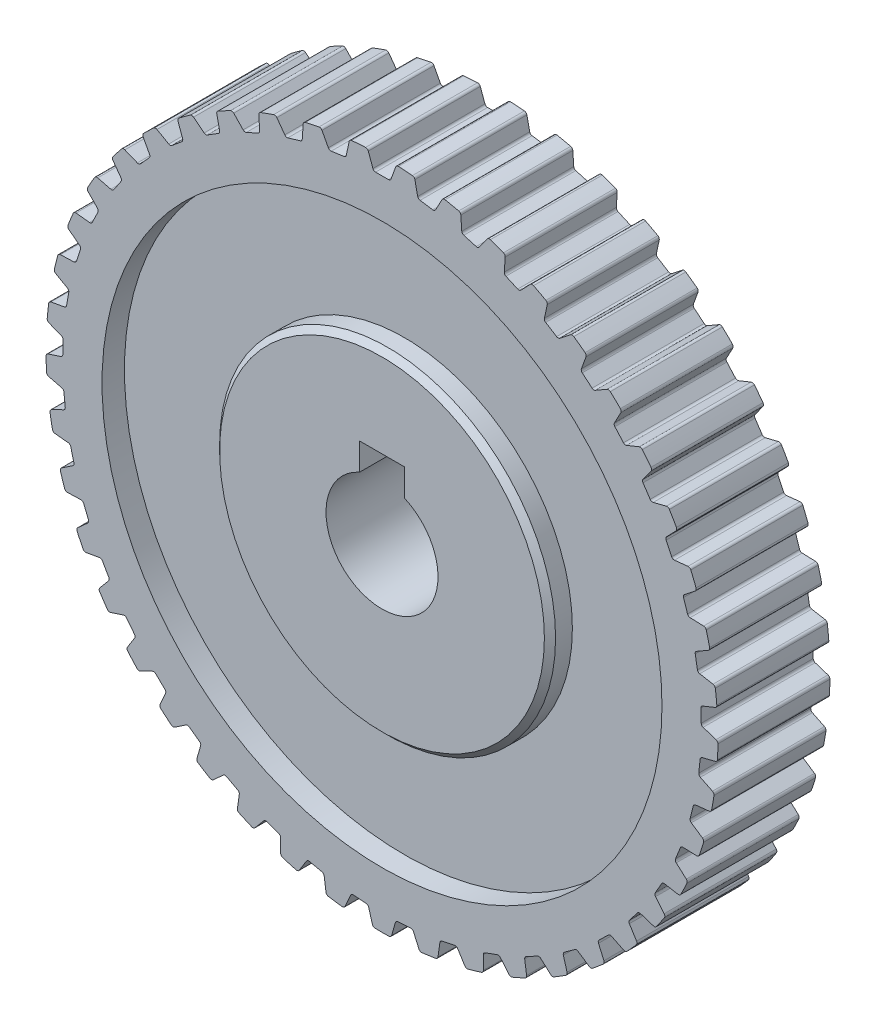
from build123d import *

# Parameters (mm, degrees)
SKETCH1_R               = 30
BOSS_EXTRUDE1_DEPTH     = 10
CUT_EXTRUDE2_DEPTH      = 44.588989435
CIRPATTERN1_COUNT       = 45
SKETCH3_R               = 25
SKETCH3_R_2             = 15
CUT_EXTRUDE_THIN1_DEPTH = 2
CHAMFER1_SIZE           = 0.5
CHAMFER2_SIZE           = 0.5
FILLET1_R               = 0.25


with BuildPart() as part:
    # Sketch1 → Boss-Extrude1 (new body)
    with BuildSketch(Plane.XY):
        Circle(SKETCH1_R)
        with BuildLine():
            ThreePointArc((2, 4.582575695), (0, -5), (-2, 4.582575695))
            Line((-2, 4.582575695), (-2, 7))
            Line((-2, 7), (2, 7))
            Line((2, 7), (2, 4.582575695))
        make_face(mode=Mode.SUBTRACT)
    extrude(amount=BOSS_EXTRUDE1_DEPTH)

    # Sketch2 → Cut-Extrude2 (cut, through all)
    with BuildSketch(Plane.XY.offset(10)):
        with BuildLine():
            Line((-0.75, 28.5), (0.75, 28.5))
            Line((0.75, 28.5), (1.285919783, 29.972427501))
            ThreePointArc((1.285919783, 29.972427501), (0, 30), (-1.285919783, 29.972427501))
            Line((-1.285919783, 29.972427501), (-0.75, 28.5))
        make_face()
    cut_extrude2 = extrude(amount=-CUT_EXTRUDE2_DEPTH, mode=Mode.SUBTRACT)

    # CirPattern1: Cut-Extrude2 ×45 about axis
    cirpattern1_axis = Axis((0, 0, 10), (0, 0, -1))
    for i in range(1, CIRPATTERN1_COUNT):
        add(cut_extrude2.rotate(cirpattern1_axis, i * 360 / CIRPATTERN1_COUNT), mode=Mode.SUBTRACT)

    # Sketch3 → Cut-Extrude-Thin1 (cut)
    with BuildSketch(Plane.XY.offset(10)):
        Circle(SKETCH3_R)
        Circle(SKETCH3_R_2, mode=Mode.SUBTRACT)
    cut_extrude_thin1 = extrude(amount=-CUT_EXTRUDE_THIN1_DEPTH, mode=Mode.SUBTRACT)

    # Chamfer1
    chamfer1_edges = [part.edges().sort_by_distance(p)[0] for p in [
        (-15, 0, 10),
    ]]
    chamfer(chamfer1_edges, length=CHAMFER1_SIZE)

    # Mirror1: Cut-Extrude-Thin1 across plane
    add(cut_extrude_thin1.mirror(Plane.XY.offset(5)), mode=Mode.SUBTRACT)

    # Chamfer2
    chamfer2_edges = [part.edges().sort_by_distance(p)[0] for p in [
        (-15, 0, 0),
    ]]
    chamfer(chamfer2_edges, length=CHAMFER2_SIZE)

    # Fillet1
    fillet1_edges = [part.edges().sort_by_distance(p)[0] for p in [
        (29.942650626, -1.854096408, 5),
        (13.365630723, 26.858144303, 5),
        (12.277153421, 25.730993061, 5),
        (10.906835234, 26.341098025, 5),
        (11.01613837, 27.904205694, 5),
        (9.497626095, 28.456898963, 5),
        (8.576610913, 27.189230317, 5),
        (7.134718369, 27.602686351, 5),
        (7.025415233, 29.16579402, 5),
        (5.444760978, 29.501772453, 5),
        (4.709134429, 28.118260133, 5),
        (3.223732326, 28.327019785, 5),
        (2.897950379, 29.859703341, 5),
        (1.285919783, 29.972427501, 5),
        (0.75, 28.5, 5),
        (-0.75, 28.5, 5),
        (-1.285919783, 29.972427501, 5),
        (-2.897950379, 29.859703341, 5),
        (-3.223732326, 28.327019785, 5),
        (-4.709134429, 28.118260133, 5),
        (-5.444760978, 29.501772453, 5),
        (-7.025415233, 29.16579402, 5),
        (-7.134718369, 27.602686351, 5),
        (-8.576610913, 27.189230317, 5),
        (-9.497626095, 28.456898963, 5),
        (-11.01613837, 27.904205694, 5),
        (-10.906835234, 26.341098025, 5),
        (-12.277153421, 25.730993061, 5),
        (-13.365630723, 26.858144303, 5),
        (-14.792444905, 26.099493745, 5),
        (-14.466662959, 24.566810189, 5),
        (-15.738735103, 23.771931292, 5),
        (-16.973488552, 24.736626415, 5),
        (-18.280833326, 23.786784837, 5),
        (-17.744913544, 22.314357336, 5),
        (-18.893980208, 21.350175922, 5),
        (-20.250976734, 22.133638231, 5),
        (-21.413406121, 21.01109322, 5),
        (-20.677779571, 19.6275809, 5),
        (-21.681475481, 18.512863662, 5),
        (-23.134302688, 19.099843956, 5),
        (-24.129191322, 17.826444573, 5),
        (-23.20817614, 16.558775928, 5),
        (-24.046965495, 15.31521957, 5),
        (-25.567345756, 15.694292943, 5),
        (-26.375329261, 14.29482446, 5),
        (-25.286851959, 13.167673218, 5),
        (-25.94440868, 11.819482149, 5),
        (-27.502749521, 11.983270371, 5),
        (-28.108101418, 10.484971849, 5),
        (-26.873347969, 9.520276727, 5),
        (-27.33687346, 8.093691952, 5),
        (-28.90284355, 8.039007072, 5),
        (-29.293781353, 6.471041187, 5),
        (-27.936784828, 5.687578878, 5),
        (-28.197257094, 4.210367249, 5),
        (-29.740376607, 3.938273644, 5),
        (-29.909291155, 2.33115907, 5),
        (-28.456463948, 1.744178776, 5),
        (-28.508813193, 0.245092536, 5),
        (-29.999047061, -0.2391138, 5),
        (-29.942650626, -1.854096408, 5),
        (-28.422270365, -2.233169782, 5),
        (-28.265477671, -3.724952625, 5),
        (-29.673820188, -4.411847167, 5),
        (-29.393210462, -6.003264007, 5),
        (-27.834869621, -6.16705223, 5),
        (-27.471986777, -7.622495819, 5),
        (-28.771026159, -8.498708946, 5),
        (-28.27166489, -10.035584902, 5),
        (-26.7056948, -9.980900021, 5),
        (-26.14378491, -11.371675803, 5),
        (-27.308236832, -12.420153023, 5),
        (-26.59984352, -13.872574552, 5),
        (-25.056724008, -13.600480947, 5),
        (-24.306724008, -14.899519053, 5),
        (-25.313923738, -16.099852949, 5),
        (-24.410286453, -17.439550318, 5),
        (-22.920052584, -16.955343982, 5),
        (-21.996560371, -18.137360112, 5),
        (-22.826903912, -19.466187551, 5),
        (-21.745610926, -20.667085074, 5),
        (-20.337268408, -19.980190532, 5),
        (-19.258258708, -21.022178087, 5),
        (-19.895584367, -22.453634955, 5),
        (-18.657681818, -23.492358527, 5),
        (-17.358642436, -22.6161454, 5),
        (-16.145116945, -23.497823279, 5),
        (-16.577019903, -25.004047895, 5),
        (-15.206602156, -25.860379944, 5),
        (-14.042150234, -24.811902724, 5),
        (-12.717728845, -25.516110069, 5),
        (-12.935802603, -27.067785484, 5),
        (-11.45954328, -27.725058482, 5),
        (-10.45234355, -26.524724585, 5),
        (-9.042804619, -27.0377548, 5),
        (-9.042804619, -28.604679418, 5),
        (-7.48943743, -29.050100292, 5),
        (-6.659093889, -27.721272853, 5),
        (-5.191872488, -28.033140389, 5),
        (-4.97379873, -29.584815805, 5),
        (-3.373558199, -29.809714945, 5),
        (-2.736232539, -28.378258077, 5),
        (-1.239886464, -28.482892788, 5),
        (-0.807983505, -29.989117404, 5),
        (0.807983505, -29.989117404, 5),
        (1.239886464, -28.482892788, 5),
        (2.736232539, -28.378258077, 5),
        (3.373558199, -29.809714945, 5),
        (4.97379873, -29.584815805, 5),
        (5.191872488, -28.033140389, 5),
        (6.659093889, -27.721272853, 5),
        (7.48943743, -29.050100292, 5),
        (9.042804619, -28.604679418, 5),
        (9.042804619, -27.0377548, 5),
        (10.45234355, -26.524724585, 5),
        (11.45954328, -27.725058482, 5),
        (12.935802603, -27.067785484, 5),
        (12.717728845, -25.516110069, 5),
        (14.042150234, -24.811902724, 5),
        (15.206602156, -25.860379944, 5),
        (16.577019903, -25.004047895, 5),
        (16.145116945, -23.497823279, 5),
        (17.358642436, -22.6161454, 5),
        (18.657681818, -23.492358527, 5),
        (19.895584367, -22.453634955, 5),
        (19.258258708, -21.022178087, 5),
        (20.337268408, -19.980190532, 5),
        (21.745610926, -20.667085074, 5),
        (22.826903912, -19.466187551, 5),
        (21.996560371, -18.137360112, 5),
        (22.920052584, -16.955343982, 5),
        (24.410286453, -17.439550318, 5),
        (25.313923738, -16.099852949, 5),
        (25.056724008, -13.600480947, 5),
        (24.306724008, -14.899519053, 5),
        (26.59984352, -13.872574552, 5),
        (26.14378491, -11.371675803, 5),
        (27.308236832, -12.420153023, 5),
        (26.7056948, -9.980900021, 5),
        (28.27166489, -10.035584902, 5),
        (28.771026159, -8.498708946, 5),
        (27.471986777, -7.622495819, 5),
        (27.834869621, -6.16705223, 5),
        (29.393210462, -6.003264007, 5),
        (29.673820188, -4.411847167, 5),
        (28.265477671, -3.724952625, 5),
        (28.422270365, -2.233169782, 5),
        (29.999047061, -0.2391138, 5),
        (28.508813193, 0.245092536, 5),
        (28.456463948, 1.744178776, 5),
        (29.909291155, 2.33115907, 5),
        (29.740376607, 3.938273644, 5),
        (28.197257094, 4.210367249, 5),
        (27.936784828, 5.687578878, 5),
        (29.293781353, 6.471041187, 5),
        (28.90284355, 8.039007072, 5),
        (27.33687346, 8.093691952, 5),
        (26.873347969, 9.520276727, 5),
        (28.108101418, 10.484971849, 5),
        (27.502749521, 11.983270371, 5),
        (25.94440868, 11.819482149, 5),
        (25.286851959, 13.167673218, 5),
        (26.375329261, 14.29482446, 5),
        (25.567345756, 15.694292943, 5),
        (24.046965495, 15.31521957, 5),
        (23.20817614, 16.558775928, 5),
        (24.129191322, 17.826444573, 5),
        (23.134302688, 19.099843956, 5),
        (21.681475481, 18.512863662, 5),
        (20.677779571, 19.6275809, 5),
        (21.413406121, 21.01109322, 5),
        (20.250976734, 22.133638231, 5),
        (18.893980208, 21.350175922, 5),
        (17.744913544, 22.314357336, 5),
        (18.280833326, 23.786784837, 5),
        (14.792444905, 26.099493745, 5),
        (15.738735103, 23.771931292, 5),
        (14.466662959, 24.566810189, 5),
        (16.973488552, 24.736626415, 5),
    ]]
    fillet(fillet1_edges, radius=FILLET1_R)


solid = part.part
